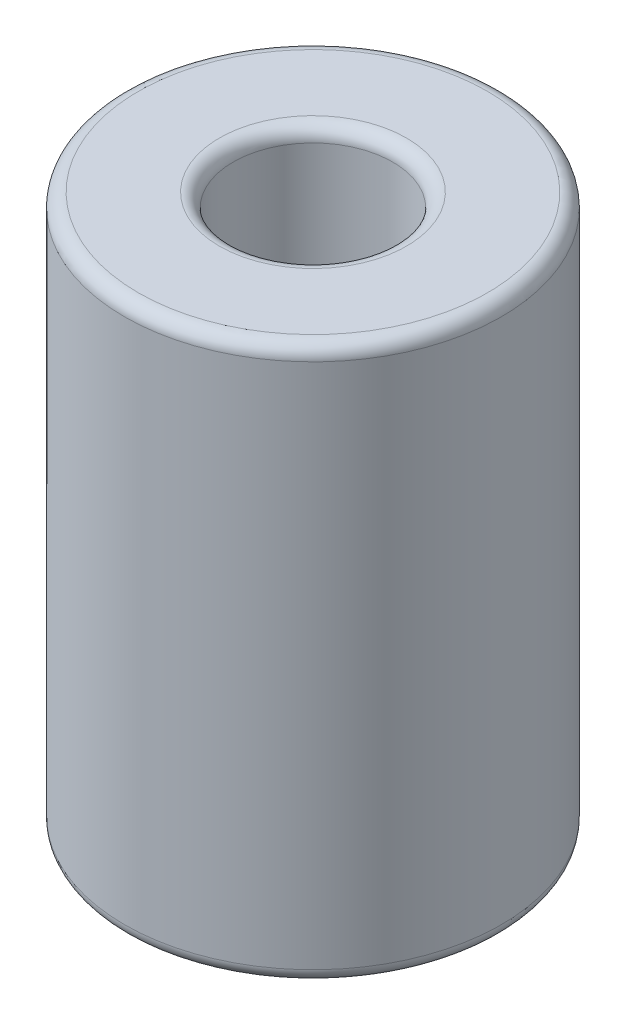
from build123d import *

# Parameters (mm, degrees)
SKETCH1_R           = 5.3975
SKETCH1_R_2         = 2.286
BOSS_EXTRUDE1_DEPTH = 15.875
FILLET1_R           = 0.396875


with BuildPart() as part:
    # Sketch1 → Boss-Extrude1 (new body)
    with BuildSketch(Plane(origin=(0, 0, 0), x_dir=(1, 0, 0), z_dir=(0, 1, 0))):
        Circle(SKETCH1_R)
        Circle(SKETCH1_R_2, mode=Mode.SUBTRACT)
    extrude(amount=BOSS_EXTRUDE1_DEPTH)

    # Fillet1
    fillet1_edges = [part.edges().sort_by_distance(p)[0] for p in [
        (-2.286, 0, 0),
        (-5.3975, 0, 0),
        (-2.286, 15.875, 0),
        (-5.3975, 15.875, 0),
    ]]
    fillet(fillet1_edges, radius=FILLET1_R)


solid = part.part
